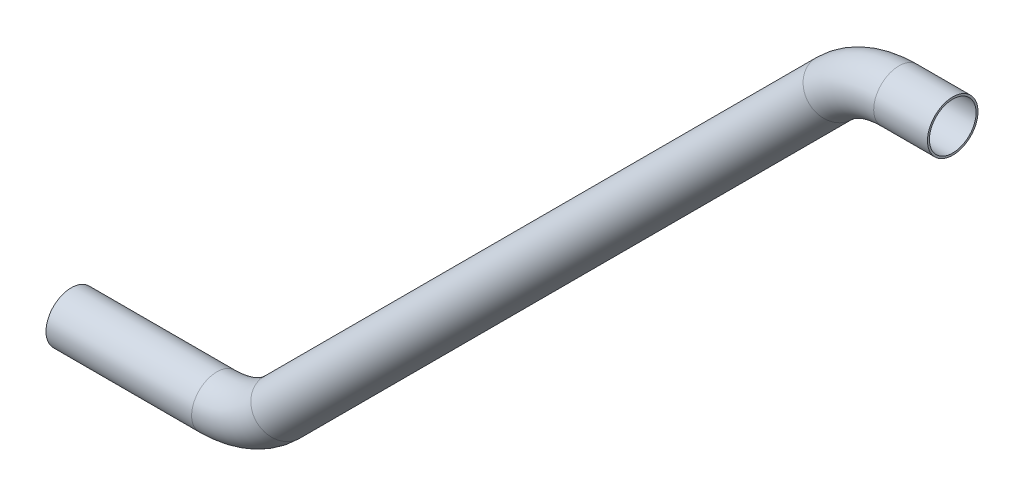
from build123d import *

# Parameters (mm, degrees)
BARRER2_PROFILE_R = 41.275
VACIADO1_T        = -3.175


with BuildPart() as part:
    # Barrer2: sweep along a path in Croquis1
    with BuildLine(Plane.XY) as barrer2_path:
        Line((0, 0), (237.867965644, 0))
        ThreePointArc((237.867965644, 0), (295.270480499, 11.418070123), (343.933982822, 43.933982822))
        Line((343.933982822, 43.933982822), (1246.015510839, 946.015510839))
        ThreePointArc((1246.015510839, 946.015510839), (1294.679013162, 978.531423538), (1352.081528017, 989.949493661))
        Line((1352.081528017, 989.949493661), (1439.949493661, 989.949493661))
    # Barrer2 profile (on start of the path) → Barrer2 (sweep)
    with BuildSketch(Plane(origin=(0, 0, 0), x_dir=(0, 0, 1), z_dir=(1, 0, 0))):
        Circle(BARRER2_PROFILE_R)
    sweep(path=barrer2_path.line)

    # Vaciado1
    vaciado1_openings = [part.faces().sort_by_distance(p)[0] for p in [
        (1439.949493661, 989.949493661, 0),
    ]]
    offset(amount=VACIADO1_T, openings=vaciado1_openings, kind=Kind.INTERSECTION)


solid = part.part
